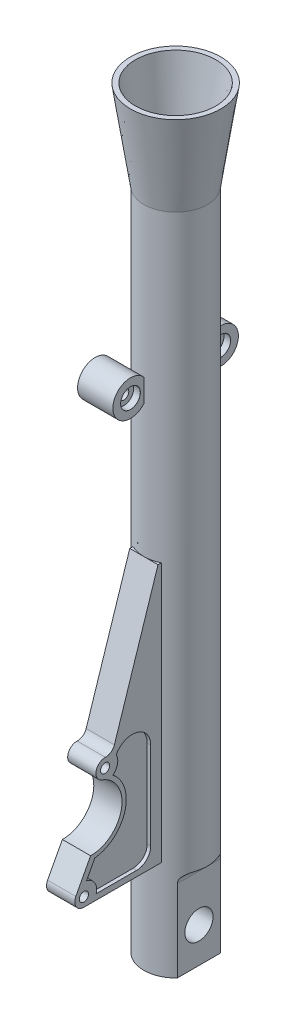
from build123d import *

# Parameters (mm, degrees)
SKETCH1_R                = 22.5
BOSS_EXTRUDE1_DEPTH      = 470
SKETCH2_R                = 32
CUT_EXTRUDE1_DEPTH       = 536.415959904
HOLE1_START              = -16.5
HOLE1_OUTLINE_R          = 10
HOLE1_DEPTH              = 33
SKETCH5_R                = 12.5
BOSS_EXTRUDE2_DEPTH      = 25
BOSS_EXTRUDE3_REACH      = 553.123
BOSS_EXTRUDE3_END_RADIUS = 22.5
SKETCH8_W                = 20
SKETCH8_H                = 184
CUT_EXTRUDE2_DEPTH       = 543.665873365
SKETCH11_R               = 3.25
CUT_EXTRUDE3_DEPTH       = 542.321069343
CUT_EXTRUDE4_DEPTH       = 2.5


# Read off the part's stored shape, not the designer's step: Shell1, Hole1
with BuildPart() as part:
    # Sketch1 → Boss-Extrude1 (new body)
    with BuildSketch(Plane(origin=(0, 0, 0), x_dir=(1, 0, 0), z_dir=(0, 1, 0))):
        with Locations(Location((0, 0, 0), (0, 0, 90))):
            Circle(SKETCH1_R)
    extrude(amount=BOSS_EXTRUDE1_DEPTH)

    # Sketch2 → section 0 of loft1
    with BuildSketch(Plane(origin=(0, 533.5, 0), x_dir=(1, 0, 0), z_dir=(0, 1, 0)), mode=Mode.PRIVATE) as loft1_s0:
        Circle(SKETCH2_R)
    # loft up to a face of the part (loft1)
    loft([loft1_s0.sketch, Face(Wire([part.edges().sort_by_distance((-16.401794117, 470, 15.402309883))[0]]))])

    # Shell1 outline → Shell1 (revolve, cut)
    with BuildSketch(Plane.XY):
        Polygon((28.461048171, 533.5), (0, 533.5), (0, 67), (19, 67), (19, 470.260362226), align=None)
    revolve(axis=Axis((0, 0, 0), (0, 1, 0)), mode=Mode.SUBTRACT)

    # Sketch3 → Cut-Extrude1 (cut, symmetric)
    with BuildSketch(Plane.XY):
        with BuildLine():
            Line((22.5, 64), (44.504485309, 64))
            Line((44.504485309, 64), (44.504485309, -12.1793828))
            Line((44.504485309, -12.1793828), (16.5, -12.1793828))
            Line((16.5, -12.1793828), (16.5, 58))
            ThreePointArc((16.5, 58), (18.257359313, 62.242640687), (22.5, 64))
        make_face()
    cut_extrude1 = extrude(amount=CUT_EXTRUDE1_DEPTH, both=True, mode=Mode.SUBTRACT)

    # Mirror1: Cut-Extrude1 across plane
    add(cut_extrude1.mirror(Plane(origin=(0, 0, 0), x_dir=(0, 0, 1), z_dir=(1, 0, 0))), mode=Mode.SUBTRACT)

    # Hole1 outline → Hole1 (cut)
    with BuildSketch(Plane.YZ.offset(HOLE1_START)):
        with Locations((25, 0)):
            Circle(HOLE1_OUTLINE_R)
    extrude(amount=HOLE1_DEPTH, mode=Mode.SUBTRACT)

    # Sketch5 → Boss-Extrude2 (add)
    with BuildSketch(Plane(origin=(0, 0, 0), x_dir=(0, 0, -1), z_dir=(1, 0, 0))):
        with Locations((-32, 356)):
            Circle(SKETCH5_R)
    boss_extrude2 = extrude(amount=-BOSS_EXTRUDE2_DEPTH)

    # Sketch7 → CBORE for M6 Hex Head Machine Screw1 (revolve, cut)
    with BuildSketch(Plane(origin=(0, 356, 32), x_dir=(0, 0, -1), z_dir=(0, 1, 0))):
        Polygon((0, 0), (0, 32.0001), (3.5, 32.0001), (3.5, 4.7), (6.975, 4.7), (6.975, 0.025), (7, 0), align=None)
    cbore_for_m6_hex_head_machine_screw1 = revolve(axis=Axis((6.35, 356, 32), (-1, 0, 0)), mode=Mode.SUBTRACT)

    # Mirror2: Boss-Extrude2, CBORE for M6 Hex Head Machine Screw1 across plane
    add(boss_extrude2.mirror(Plane.XY))
    add(cbore_for_m6_hex_head_machine_screw1.mirror(Plane.XY), mode=Mode.SUBTRACT)

    # Boss-Extrude3: up to this cylinder (the profile starts outside it)
    boss_extrude3_end = Plane(origin=(0, 162, 0), z_dir=(0, -1, 0)) * Cylinder(BOSS_EXTRUDE3_END_RADIUS, 1152.246, mode=Mode.PRIVATE)
    # Sketch8 → Boss-Extrude3 (add, up to the surface)
    with BuildSketch(Plane.XY.offset(90), mode=Mode.PRIVATE) as boss_extrude3_sk1:
        with Locations((0, 162)):
            Rectangle(SKETCH8_W, SKETCH8_H)
    boss_extrude3_tool1 = extrude(boss_extrude3_sk1.sketch, amount=-BOSS_EXTRUDE3_REACH, mode=Mode.PRIVATE) - boss_extrude3_end
    add(boss_extrude3_tool1.solids().sort_by_distance((0, 162, 90))[0])

    # Sketch10 → Cut-Extrude2 (cut, through all)
    with BuildSketch(Plane(origin=(10, 0, 0), x_dir=(0, 0, -1), z_dir=(1, 0, 0))):
        with BuildLine():
            Line((-90, 70), (-90, 254))
            Line((-90, 254), (-22.5, 254))
            Line((-22.5, 254), (-53.39120023, 158.926661609))
            ThreePointArc((-53.39120023, 158.926661609), (-55.83933924, 155.614626187), (-59.786533793, 154.438778235))
            ThreePointArc((-59.786533793, 154.438778235), (-66.375955373, 149.206085442), (-62.280701754, 141.855544753))
            ThreePointArc((-62.280701754, 141.855544753), (-48.37626649, 117.202834204), (-70.262213343, 99.255834796))
            Line((-70.262213343, 99.255834796), (-80.739159354, 79.551565158))
            ThreePointArc((-80.739159354, 79.551565158), (-80.571587455, 73.152252513), (-75, 70))
            Line((-75, 70), (-90, 70))
        make_face()
    extrude(amount=-CUT_EXTRUDE2_DEPTH, mode=Mode.SUBTRACT)

    # Sketch11 → Cut-Extrude3 (cut, through all)
    with BuildSketch(Plane(origin=(10, 0, 0), x_dir=(0, 0, -1), z_dir=(1, 0, 0))):
        with Locations(Location((-60, 147.942284398, 0), (0, 0, 90))):
            Circle(SKETCH11_R)
        with Locations(Location((-75, 76.5, 0), (0, 0, 90))):
            Circle(SKETCH11_R)
    extrude(amount=-CUT_EXTRUDE3_DEPTH, mode=Mode.SUBTRACT)

    # Sketch12 → Cut-Extrude4 (cut)
    with BuildSketch(Plane(origin=(10, 0, 0), x_dir=(0, 0, -1), z_dir=(1, 0, 0))):
        with BuildLine():
            Line((-27.655644371, 146), (-27.655644371, 84))
            ThreePointArc((-27.655644371, 84), (-30.584576559, 76.928932188), (-37.655644371, 74))
            Line((-37.655644371, 74), (-66.354191767, 74))
            ThreePointArc((-66.354191767, 74), (-67.285494294, 81.135342674), (-73.14840788, 85.307474475))
            Line((-73.14840788, 85.307474475), (-67.247053013, 96.406308753))
            ThreePointArc((-67.247053013, 96.406308753), (-45.973818024, 114.344671566), (-54.467499716, 140.843591518))
            ThreePointArc((-54.467499716, 140.843591518), (-51.192765452, 146.089551388), (-52.076348436, 152.210275248))
            ThreePointArc((-52.076348436, 152.210275248), (-37.4516744, 158.598991088), (-27.655644371, 146))
        make_face()
    cut_extrude4 = extrude(amount=-CUT_EXTRUDE4_DEPTH, mode=Mode.SUBTRACT)

    # Mirror3: Cut-Extrude4 across plane
    add(cut_extrude4.mirror(Plane(origin=(0, 0, 0), x_dir=(0, 0, 1), z_dir=(1, 0, 0))), mode=Mode.SUBTRACT)


solid = part.part
